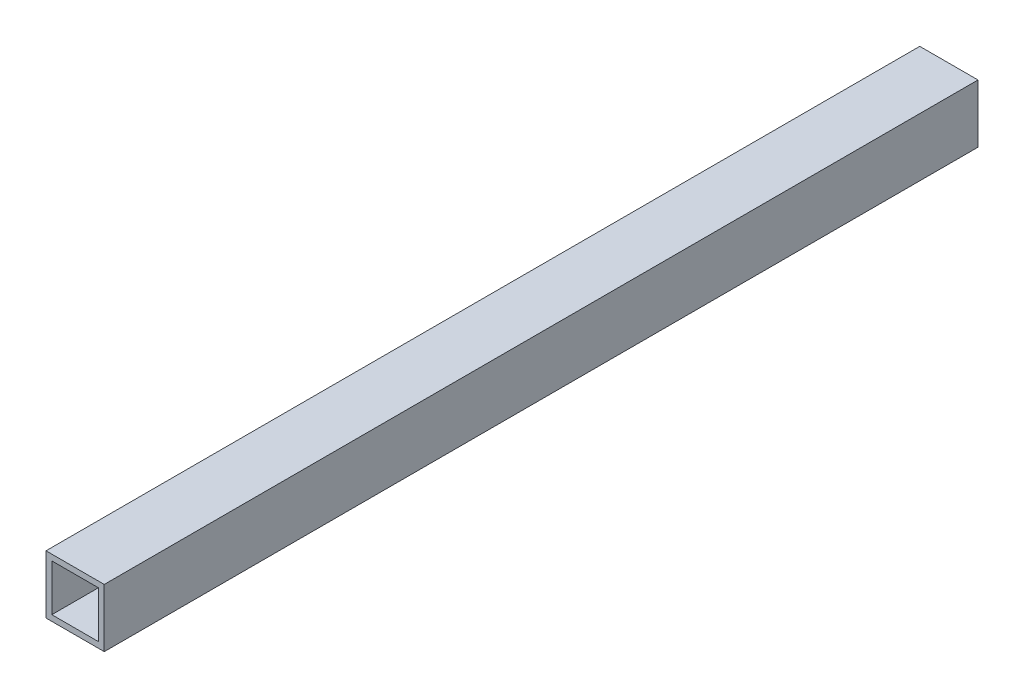
from build123d import *

# Parameters (mm, degrees)
SZKIC1_W                    = 20
SZKIC1_H                    = 20
SZKIC1_W_2                  = 16
SZKIC1_H_2                  = 16
DODANIE_WYCI_GNI_CIE1_DEPTH = 300


with BuildPart() as part:
    # Szkic1 → Dodanie-wyciągnięcie1 (new body)
    with BuildSketch(Plane.XY):
        Rectangle(SZKIC1_W, SZKIC1_H)
        Rectangle(SZKIC1_W_2, SZKIC1_H_2, mode=Mode.SUBTRACT)
    extrude(amount=DODANIE_WYCI_GNI_CIE1_DEPTH)


solid = part.part
